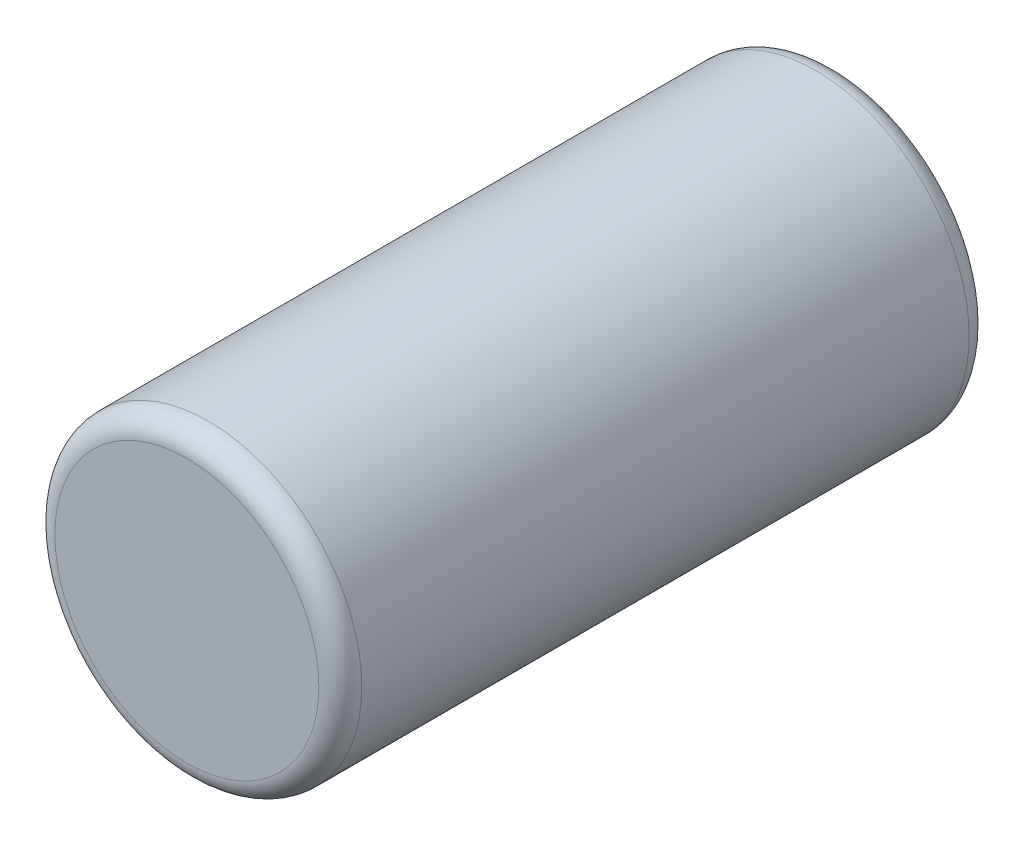
from build123d import *


with BuildPart() as part:
    # Sketch1 → Revolve1 (revolve)
    with BuildSketch(Plane(origin=(0, 0, 0), x_dir=(0, 0, -1), z_dir=(1, 0, 0))):
        with BuildLine():
            Line((0, 0), (0, 6.15))
            ThreePointArc((0, 6.15), (0.292893219, 6.857106781), (1, 7.15))
            Line((1, 7.15), (29.3, 7.15))
            ThreePointArc((29.3, 7.15), (30.007106781, 6.857106781), (30.3, 6.15))
            Line((30.3, 6.15), (30.3, 0))
            Line((30.3, 0), (0, 0))
        make_face()
    revolve(axis=Axis((0, 0, 0), (0, 0, -1)))


solid = part.part
